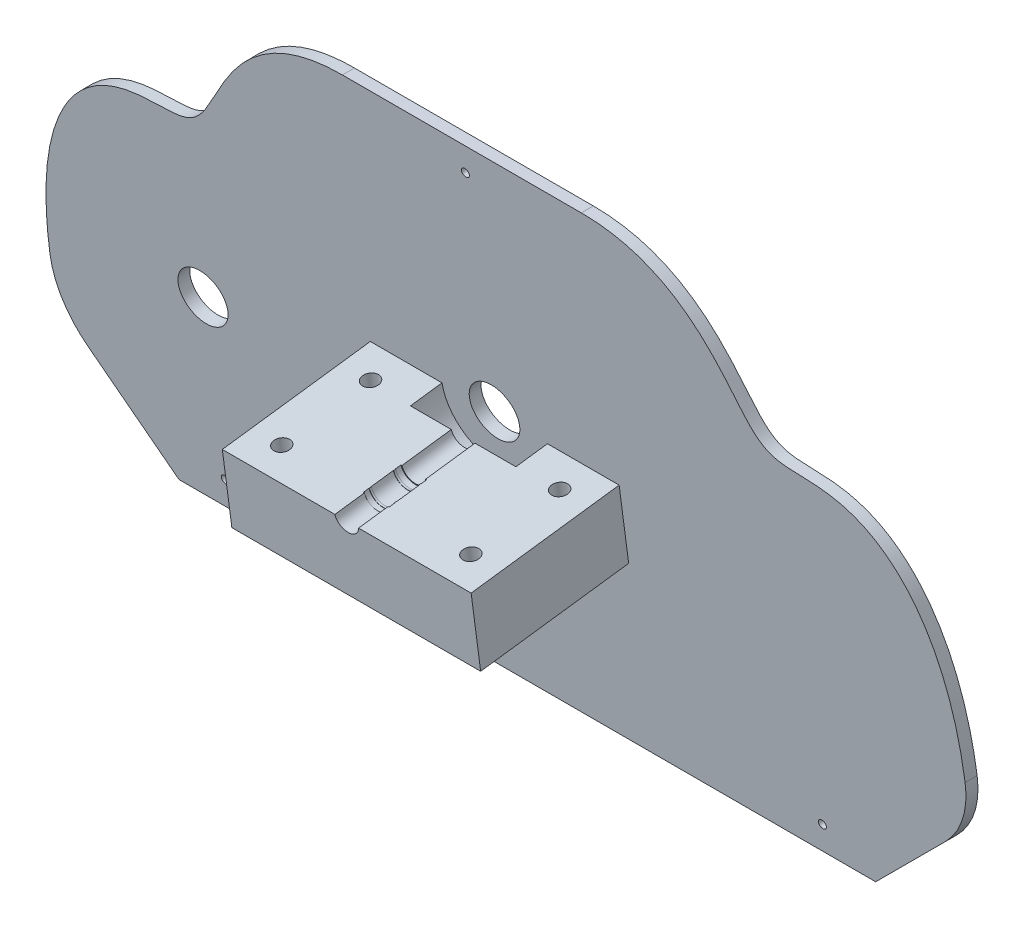
from build123d import *

# Parameters (mm, degrees)
EXTRUDE_START                                 = -25
EXTRUDE_PLATE_SHAPE_DEPTH                     = 50
CUT_EXTRUDE_ANGLE_DEPTH                       = 341.53226913
CUT_EXTRUDE_ANGLE_DEPTH_BACK                  = 341.53226913
CUT_EXTRUDE_SWITCH_HOLE_DEPTH                 = 340.963942654
CUT_EXTRUDE_SWITCH_HOLE_DEPTH_BACK            = 340.963942654
IGNITION_SWITCH_HOLE_R                        = 12.5
CUT_EXTRUDE_TOP_ENCLOSURE_HOLE_DEPTH          = 340.910991738
CUT_EXTRUDE_TOP_ENCLOSURE_HOLE_DEPTH_BACK     = 340.910991738
SKETCH23_R                                    = 2
CUT_EXTRUDE_BOTTOM_ENCLOSURE_HOLES_DEPTH      = 340.910991738
CUT_EXTRUDE_BOTTOM_ENCLOSURE_HOLES_DEPTH_BACK = 340.910991738
BOTTOM_ENCLOSURE_MOUNTING_HOLES_R             = 2
BOSS_EXTRUDE1_START                           = -6
SKETCH24_W                                    = 125
SKETCH24_H                                    = 75
BOSS_EXTRUDE1_DEPTH                           = 75
CUT_EXTRUDE_SHAFT_HOLE_DEPTH                  = 353.673456197
CUT_EXTRUDE_SHAFT_HOLE_DEPTH_BACK             = 353.673456197
STEERING_WHEEL_SHAFT_HOLE_R                   = 12.625
SKETCH26_W                                    = 456.008458956
SKETCH26_H                                    = 1.5
EXTRUDE_CUT_SLOT_DEPTH                        = 352.560815156
SKETCH28_R                                    = 4
CUT_EXTRUDE17_DEPTH                           = 288.072515557
CUT_EXTRUDE18_DEPTH                           = 355.866730753
CUT_EXTRUDE18_DEPTH_BACK                      = 75
SKETCH30_W                                    = 150
SKETCH30_H                                    = 50
CUT_EXTRUDE19_START                           = -75
SKETCH31_R                                    = 26.5
CUT_EXTRUDE19_DEPTH                           = 16
BOSS_EXTRUDE4_START                           = 16
BOSS_EXTRUDE4_DEPTH                           = 59
CUT_EXTRUDE21_DEPTH                           = 15
SKETCH44_R                                    = 6
CUT_EXTRUDE22_DEPTH                           = 25


# Read off the part's stored shape, not the designer's step: Extrude Plate Shape
with BuildPart() as part:
    # Extrude Plate Shape outline → Extrude Plate Shape (new body)
    with BuildSketch(Plane.XY.offset(EXTRUDE_START)):
        with BuildLine():
            Line((175, 0), (215.218833807, 40.218833807))
            ThreePointArc((215.218833807, 40.218833807), (226.057471223, 56.440000887), (229.863494748, 75.574172084))
            add(Edge.make_bspline(
                [(229.863494748, 75.574172084), (229.863497015, 220.574172084), (130.657195822, 208), (130.657198498, 108), (160, 250), (60, 250)],
                knots=[0, 0, 0, 0, 0, 0, 1, 1, 1, 1, 1, 1], degree=5))
            Line((60, 250), (-60, 250))
            add(Edge.make_bspline(
                [(-60, 250), (-160, 250), (-130.657198498, 108), (-130.657195822, 208), (-229.863497015, 220.574172084), (-229.863494748, 75.574172084)],
                knots=[0, 0, 0, 0, 0, 0, 1, 1, 1, 1, 1, 1], degree=5))
            ThreePointArc((-229.863494748, 75.574172084), (-226.057471223, 56.440000887), (-215.218833807, 40.218833807))
            Line((-215.218833807, 40.218833807), (-175, 0))
            Line((-175, 0), (175, 0))
        make_face()
    extrude(amount=EXTRUDE_PLATE_SHAPE_DEPTH)

    # 5-Degree Front Plate → Cut-Extrude Angle (cut, two sides: drawn at the far end of the back side and taken through both)
    with BuildSketch(Plane(origin=(0, 0, 0), x_dir=(0, 0, -1), z_dir=(1, 0, 0)).offset(-CUT_EXTRUDE_ANGLE_DEPTH_BACK)):
        Polygon((20.798974056, -10), (-14.747200293, 260), (35, 260), (35, -10), align=None)
        Polygon((-20.798974056, 260), (14.747200293, -10), (-35, -10), (-35, 260), align=None)
    extrude(amount=CUT_EXTRUDE_ANGLE_DEPTH + CUT_EXTRUDE_ANGLE_DEPTH_BACK, mode=Mode.SUBTRACT)

    # Ignition Switch Hole → Cut-Extrude Switch Hole (cut, two sides: drawn at the far end of the back side and taken through both)
    with BuildSketch(Plane(origin=(0, 2.521214434, -19.150524903), x_dir=(-1, 0, 0), z_dir=(0, 0.13052619222005532, -0.99144486137381)).offset(-CUT_EXTRUDE_SWITCH_HOLE_DEPTH_BACK)):
        with Locations(Location((150, 97.457030106, 0), (0, 0, 90))):
            Circle(IGNITION_SWITCH_HOLE_R)
    extrude(amount=CUT_EXTRUDE_SWITCH_HOLE_DEPTH + CUT_EXTRUDE_SWITCH_HOLE_DEPTH_BACK, mode=Mode.SUBTRACT)

    # Sketch23 → Cut-Extrude Top Enclosure Hole (cut, two sides: drawn at the far end of the back side and taken through both)
    with BuildSketch(Plane(origin=(0, 1.73805728, -13.201855735), x_dir=(1, 0, 0), z_dir=(0, -0.13052619222005535, 0.99144486137381)).offset(-CUT_EXTRUDE_TOP_ENCLOSURE_HOLE_DEPTH_BACK)):
        with Locations(Location((0, 236.854185237, 0), (0, 0, 270))):
            Circle(SKETCH23_R)
    extrude(amount=CUT_EXTRUDE_TOP_ENCLOSURE_HOLE_DEPTH + CUT_EXTRUDE_TOP_ENCLOSURE_HOLE_DEPTH_BACK, mode=Mode.SUBTRACT)

    # Bottom Enclosure Mounting Holes → Cut-Extrude Bottom Enclosure Holes (cut, two sides: drawn at the far end of the back side and taken through both)
    with BuildSketch(Plane(origin=(0, 1.73805728, -13.201855735), x_dir=(1, 0, 0), z_dir=(0, -0.13052619222005535, 0.99144486137381)).offset(-CUT_EXTRUDE_BOTTOM_ENCLOSURE_HOLES_DEPTH_BACK)):
        with Locations(Location((150, 11.746945092, 0), (0, 0, 270))):
            Circle(BOTTOM_ENCLOSURE_MOUNTING_HOLES_R)
        with Locations(Location((-150, 11.746945092, 0), (0, 0, 270))):
            Circle(BOTTOM_ENCLOSURE_MOUNTING_HOLES_R)
    extrude(amount=CUT_EXTRUDE_BOTTOM_ENCLOSURE_HOLES_DEPTH + CUT_EXTRUDE_BOTTOM_ENCLOSURE_HOLES_DEPTH_BACK, mode=Mode.SUBTRACT)

    # Sketch24 → Boss-Extrude1 (add)
    with BuildSketch(Plane(origin=(0, 2.521214434, -19.150524903), x_dir=(-1, 0, 0), z_dir=(0, 0.13052619222005538, -0.99144486137381)).offset(BOSS_EXTRUDE1_START)):
        with Locations((0, 124.614270251)):
            Rectangle(SKETCH24_W, SKETCH24_H)
    extrude(amount=-BOSS_EXTRUDE1_DEPTH)

    # Steering Wheel Shaft Hole → Cut-Extrude Shaft Hole (cut, two sides: drawn at the far end of the back side and taken through both)
    with BuildSketch(Plane(origin=(0, 2.521214434, -19.150524903), x_dir=(-1, 0, 0), z_dir=(0, 0.13052619222005532, -0.99144486137381)).offset(-CUT_EXTRUDE_SHAFT_HOLE_DEPTH_BACK)):
        with Locations(Location((0, 124.614270251, 0), (0, 0, 90))):
            Circle(STEERING_WHEEL_SHAFT_HOLE_R)
    extrude(amount=CUT_EXTRUDE_SHAFT_HOLE_DEPTH + CUT_EXTRUDE_SHAFT_HOLE_DEPTH_BACK, mode=Mode.SUBTRACT)

    # Sketch26 → Extrude-Cut Slot (cut, through all)
    with BuildSketch(Plane(origin=(0, 1.73805728, -13.201855735), x_dir=(1, 0, 0), z_dir=(0, -0.13052619222005535, 0.99144486137381))):
        with Locations((0, 124.614270251)):
            Rectangle(SKETCH26_W, SKETCH26_H)
    extrude(amount=EXTRUDE_CUT_SLOT_DEPTH, mode=Mode.SUBTRACT)

    # Sketch28 → Cut-Extrude17 (cut, through all)
    with BuildSketch(Plane(origin=(0, 160.727360196, 21.1601584), x_dir=(1, 0, 0), z_dir=(0, 0.99144486137381, 0.1305261922200554))):
        with Locations(Location((-47.5, -46.684225972, 0), (0, 0, 270))):
            Circle(SKETCH28_R)
        with Locations(Location((-47.5, -1.684225972, 0), (0, 0, 270))):
            Circle(SKETCH28_R)
        with Locations(Location((47.5, -46.684225972, 0), (0, 0, 90))):
            Circle(SKETCH28_R)
        with Locations(Location((47.5, -1.684225972, 0), (0, 0, 270))):
            Circle(SKETCH28_R)
    extrude(amount=-CUT_EXTRUDE17_DEPTH, mode=Mode.SUBTRACT)

    # Sketch30 → Cut-Extrude18 (cut, two sides: drawn at the far end of the back side and taken through both)
    with BuildSketch(Plane(origin=(0, -8.051407136, 61.156508868), x_dir=(1, 0, 0), z_dir=(0, -0.1305261922200554, 0.99144486137381)).offset(-CUT_EXTRUDE18_DEPTH_BACK)):
        with Locations((0, 149.614270251)):
            Rectangle(SKETCH30_W, SKETCH30_H)
    extrude(amount=CUT_EXTRUDE18_DEPTH + CUT_EXTRUDE18_DEPTH_BACK, mode=Mode.SUBTRACT)

    # Sketch31 → Cut-Extrude19 (cut)
    with BuildSketch(Plane(origin=(0, -8.051407136, 61.156508868), x_dir=(1, 0, 0), z_dir=(0, -0.1305261922200554, 0.99144486137381)).offset(CUT_EXTRUDE19_START)):
        with Locations((0, 124.614270251)):
            Circle(SKETCH31_R)
    extrude(amount=CUT_EXTRUDE19_DEPTH, mode=Mode.SUBTRACT)

    # Sketch37 → Boss-Extrude4 (add)
    with BuildSketch(Plane(origin=(0, 1.73805728, -13.201855735), x_dir=(1, 0, 0), z_dir=(0, -0.13052619222005535, 0.99144486137381)).offset(BOSS_EXTRUDE4_START)):
        with BuildLine():
            Line((-12.602703083, 123.864270251), (12.602703083, 123.864270251))
            ThreePointArc((12.602703083, 123.864270251), (0, 111.989270251), (-12.602703083, 123.864270251))
        make_face()
    extrude(amount=BOSS_EXTRUDE4_DEPTH)

    # Sketch36 → Cut-Revolve3 (revolve, cut)
    with BuildSketch(Plane(origin=(0, 0, 0), x_dir=(0, 0, -1), z_dir=(1, 0, 0))):
        Polygon((-61.70184189, 111.010272043), (-58.876224036, 111.382271691), (-58.895802964, 111.53098842), (-57.904358103, 111.661514612), (-57.884779174, 111.512797883), (-46.681452241, 112.987743855), (-46.701031169, 113.136460584), (-45.709586308, 113.266986776), (-45.690007379, 113.118270047), (-42.864389524, 113.490269695), (-43.712809774, 119.934661294), (-62.55026214, 117.454663642), align=None)
    revolve(axis=Axis((0, 115.519900445, 77.24624765), (0, 0.1305261922200553, -0.9914448613738099)), mode=Mode.SUBTRACT)

    # Sketch42 → Cut-Extrude21 (cut)
    with BuildSketch(Plane(origin=(0, -8.051407136, 61.156508868), x_dir=(1, 0, 0), z_dir=(0, -0.1305261922200554, 0.99144486137381))):
        with BuildLine():
            Line((-5.95294045, 123.864270251), (5.95294045, 123.864270251))
            ThreePointArc((5.95294045, 123.864270251), (0, 118.614270251), (-5.95294045, 123.864270251))
        make_face()
    extrude(amount=-CUT_EXTRUDE21_DEPTH, mode=Mode.SUBTRACT)

    # Sketch44 → Cut-Extrude22 (cut)
    with BuildSketch(Plane(origin=(0, -3.613516601, 27.447383582), x_dir=(1, 0, 0), z_dir=(0, -0.13052619222005532, 0.99144486137381))):
        with Locations((0, 124.614270251)):
            Circle(SKETCH44_R)
    extrude(amount=-CUT_EXTRUDE22_DEPTH, mode=Mode.SUBTRACT)


solid = part.part
